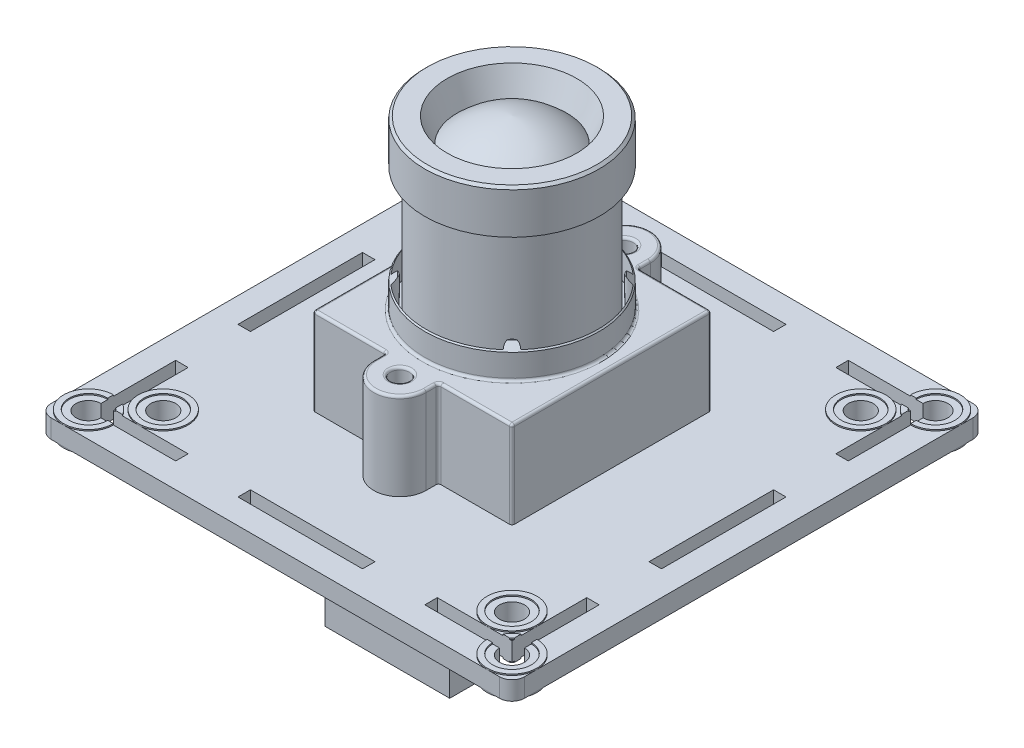
from build123d import *

# Parameters (mm, degrees)
SKETCH1_R                 = 1
PCB_DEPTH                 = 1.5
SKETCH2_R                 = 0.75
LENS_MOUNT_DEPTH          = 7
BOSS_EXTRUDE3_OUTLINE_R   = 7
BOSS_EXTRUDE3_DEPTH       = 2.5
CHAMFER1_SIZE             = 0.5
MOUNTING_HOLES_DEPTH      = 0.1
MOUNTING_HOLES_DEPTH_BACK = 1.6
SKETCH4_R                 = 2
SKETCH4_R_2               = 1.55
SKETCH5_R                 = 6.25
LENS_THREAD_DEPTH         = 10
SKETCH6_R                 = 7
LENS_GLASS_SURROUND_DEPTH = 3.5
CHAMFER2_SIZE             = 0.2
SKETCH7_R                 = 5.2
LENS_RECESS_DEPTH         = 2
CHAMFER3_SIZE2            = 0.808052452
CHAMFER3_SIZE             = 2
SKETCH10_R                = 4.391947548
LENS_CAVITY_DEPTH         = 10
CHAMFER4_SIZE             = 9
CHAMFER4_SIZE2            = 1.913009055
SKETCH11_W                = 10
SKETCH11_H                = 4
BOSS_EXTRUDE4_DEPTH       = 6
SKETCH12_W                = 9
SKETCH12_H                = 3
SKETCH12_W_2              = 2
SKETCH12_H_2              = 0.5
CUT_EXTRUDE1_DEPTH        = 5.5
SKETCH13_W                = 1
SKETCH13_H                = 1
BOSS_EXTRUDE5_DEPTH       = 5.5
BOSS_EXTRUDE5_2_DEPTH     = 5.5
BOSS_EXTRUDE5_3_DEPTH     = 5.5
BOSS_EXTRUDE5_4_DEPTH     = 5.5
CHAMFER5_SIZE             = 0.4
CHAMFER6_SIZE             = 0.4
CHAMFER7_SIZE             = 0.4
CHAMFER8_SIZE             = 0.4
FILLET1_R                 = 0.2
CUT_EXTRUDE2_DEPTH        = 35.727510772
CUT_EXTRUDE2_DEPTH_BACK   = 35.727510772
SKETCH14_W                = 10
SKETCH14_H                = 1
SKETCH14_W_2              = 1
SKETCH14_H_2              = 10


# Read off the part's stored shape, not the designer's step: Boss-Extrude3
# Some blends are built 0.0001 mm under size
with BuildPart() as part:
    # Sketch1 → PCB (new body)
    with BuildSketch(Plane(origin=(0, 0, 0), x_dir=(1, 0, 0), z_dir=(0, 1, 0))):
        with BuildLine():
            Line((-18, -19), (18, -19))
            ThreePointArc((18, -19), (18.707106781, -18.707106781), (19, -18))
            Line((19, -18), (19, 18))
            ThreePointArc((19, 18), (18.707106781, 18.707106781), (18, 19))
            Line((18, 19), (-18, 19))
            ThreePointArc((-18, 19), (-18.707106781, 18.707106781), (-19, 18))
            Line((-19, 18), (-19, -18))
            ThreePointArc((-19, -18), (-18.707106781, -18.707106781), (-18, -19))
        make_face()
        with Locations(Location((-17, -17, 0), (0, 0, 270))):
            Circle(SKETCH1_R, mode=Mode.SUBTRACT)
        with Locations(Location((17, -17, 0), (0, 0, 270))):
            Circle(SKETCH1_R, mode=Mode.SUBTRACT)
        with Locations(Location((17, 17, 0), (0, 0, 270))):
            Circle(SKETCH1_R, mode=Mode.SUBTRACT)
        with Locations(Location((-17, 17, 0), (0, 0, 270))):
            Circle(SKETCH1_R, mode=Mode.SUBTRACT)
        with Locations(Location((-14, 14, 0), (0, 0, 270))):
            Circle(SKETCH1_R, mode=Mode.SUBTRACT)
        with Locations(Location((14, -14, 0), (0, 0, 270))):
            Circle(SKETCH1_R, mode=Mode.SUBTRACT)
        with Locations(Location((14, 14, 0), (0, 0, 270))):
            Circle(SKETCH1_R, mode=Mode.SUBTRACT)
        with Locations(Location((-14, -14, 0), (0, 0, 270))):
            Circle(SKETCH1_R, mode=Mode.SUBTRACT)
    extrude(amount=PCB_DEPTH)

    # Sketch2 → Lens Mount (add)
    with BuildSketch(Plane(origin=(0, 1.5, 0), x_dir=(1, 0, 0), z_dir=(0, 1, 0))):
        with BuildLine():
            Line((-8, 8), (-8, -8))
            Line((-8, -8), (-2.1, -8))
            Line((-2.1, -8), (-2.1, -9))
            ThreePointArc((-2.1, -9), (0, -11.1), (2.1, -9))
            Line((2.1, -9), (2.1, -8))
            Line((2.1, -8), (8, -8))
            Line((8, -8), (8, 8))
            Line((8, 8), (2.1, 8))
            Line((2.1, 8), (2.1, 9))
            ThreePointArc((2.1, 9), (0, 11.1), (-2.1, 9))
            Line((-2.1, 9), (-2.1, 8))
            Line((-2.1, 8), (-8, 8))
        make_face()
        with Locations(Location((0, 9, 0), (0, 0, 270))):
            Circle(SKETCH2_R, mode=Mode.SUBTRACT)
        with Locations(Location((0, -9, 0), (0, 0, 270))):
            Circle(SKETCH2_R, mode=Mode.SUBTRACT)
    extrude(amount=LENS_MOUNT_DEPTH)

    # Boss-Extrude3 outline → Boss-Extrude3 (add)
    with BuildSketch(Plane(origin=(0, 8.5, 0), x_dir=(1, 0, 0), z_dir=(0, 1, 0))):
        Circle(BOSS_EXTRUDE3_OUTLINE_R)
        with BuildLine():
            ThreePointArc((-4.512905634, -5.219548136), (-4.5254834, -4.5254834), (-5.219548136, -4.512905634))
            ThreePointArc((-5.219548136, -4.512905634), (-6.9, 0), (-5.219548136, 4.512905634))
            ThreePointArc((-5.219548136, 4.512905634), (-4.5254834, 4.5254834), (-4.512905634, 5.219548136))
            ThreePointArc((-4.512905634, 5.219548136), (0, 6.9), (4.512905634, 5.219548136))
            ThreePointArc((4.512905634, 5.219548136), (4.5254834, 4.5254834), (5.219548136, 4.512905634))
            ThreePointArc((5.219548136, 4.512905634), (6.9, 0), (5.219548136, -4.512905634))
            ThreePointArc((5.219548136, -4.512905634), (4.5254834, -4.5254834), (4.512905634, -5.219548136))
            ThreePointArc((4.512905634, -5.219548136), (0, -6.9), (-4.512905634, -5.219548136))
        make_face(mode=Mode.SUBTRACT)
    extrude(amount=BOSS_EXTRUDE3_DEPTH)

    # Chamfer1
    # the kernel refuses this chamfer: 0.5 mm, written as the material it takes off along each edge
    with BuildSketch(Plane(origin=(0, 11, 0), x_dir=(1, 0, 0), z_dir=(0, 0, 1))) as chamfer1_piece_1:
        Polygon((7, -CHAMFER1_SIZE), (7 - CHAMFER1_SIZE, 0), (7, 0), align=None)
    revolve(axis=Axis((0, 11, 0), (0, 1, 0)), mode=Mode.SUBTRACT)

    # Sketch4 → Mounting Holes (add, two sides: drawn at the far end of the back side and taken through both)
    # profile 1 of 8: a face of its own
    with BuildSketch(Plane(origin=(0, 1.5, 0), x_dir=(1, 0, 0), z_dir=(0, 1, 0)).offset(-MOUNTING_HOLES_DEPTH_BACK)):
        with Locations(Location((17, -17, 0), (0, 0, 270))):
            Circle(SKETCH4_R)
        with Locations(Location((17, -17, 0), (0, 0, 90))):
            Circle(SKETCH4_R_2, mode=Mode.SUBTRACT)
    # profile 2 of 8: a face of its own
    with BuildSketch(Plane(origin=(0, 1.5, 0), x_dir=(1, 0, 0), z_dir=(0, 1, 0)).offset(-MOUNTING_HOLES_DEPTH_BACK)):
        with Locations(Location((-17, -17, 0), (0, 0, 270))):
            Circle(SKETCH4_R)
        with Locations(Location((-17, -17, 0), (0, 0, 90))):
            Circle(SKETCH4_R_2, mode=Mode.SUBTRACT)
    # profile 3 of 8: a face of its own
    with BuildSketch(Plane(origin=(0, 1.5, 0), x_dir=(1, 0, 0), z_dir=(0, 1, 0)).offset(-MOUNTING_HOLES_DEPTH_BACK)):
        with Locations(Location((-17, 17, 0), (0, 0, 90))):
            Circle(SKETCH4_R)
        with Locations(Location((-17, 17, 0), (0, 0, 90))):
            Circle(SKETCH4_R_2, mode=Mode.SUBTRACT)
    # profile 4 of 8: a face of its own
    with BuildSketch(Plane(origin=(0, 1.5, 0), x_dir=(1, 0, 0), z_dir=(0, 1, 0)).offset(-MOUNTING_HOLES_DEPTH_BACK)):
        with Locations(Location((17, 17, 0), (0, 0, 90))):
            Circle(SKETCH4_R)
        with Locations(Location((17, 17, 0), (0, 0, 90))):
            Circle(SKETCH4_R_2, mode=Mode.SUBTRACT)
    # profile 5 of 8: a face of its own
    with BuildSketch(Plane(origin=(0, 1.5, 0), x_dir=(1, 0, 0), z_dir=(0, 1, 0)).offset(-MOUNTING_HOLES_DEPTH_BACK)):
        with Locations(Location((14, -14, 0), (0, 0, 90))):
            Circle(SKETCH4_R)
        with Locations(Location((14, -14, 0), (0, 0, 90))):
            Circle(SKETCH4_R_2, mode=Mode.SUBTRACT)
    # profile 6 of 8: a face of its own
    with BuildSketch(Plane(origin=(0, 1.5, 0), x_dir=(1, 0, 0), z_dir=(0, 1, 0)).offset(-MOUNTING_HOLES_DEPTH_BACK)):
        with Locations(Location((-14, -14, 0), (0, 0, 90))):
            Circle(SKETCH4_R)
        with Locations(Location((-14, -14, 0), (0, 0, 90))):
            Circle(SKETCH4_R_2, mode=Mode.SUBTRACT)
    # profile 7 of 8: a face of its own
    with BuildSketch(Plane(origin=(0, 1.5, 0), x_dir=(1, 0, 0), z_dir=(0, 1, 0)).offset(-MOUNTING_HOLES_DEPTH_BACK)):
        with Locations(Location((-14, 14, 0), (0, 0, 90))):
            Circle(SKETCH4_R)
        with Locations(Location((-14, 14, 0), (0, 0, 90))):
            Circle(SKETCH4_R_2, mode=Mode.SUBTRACT)
    # profile 8 of 8: a face of its own
    with BuildSketch(Plane(origin=(0, 1.5, 0), x_dir=(1, 0, 0), z_dir=(0, 1, 0)).offset(-MOUNTING_HOLES_DEPTH_BACK)):
        with Locations(Location((14, 14, 0), (0, 0, 90))):
            Circle(SKETCH4_R)
        with Locations(Location((14, 14, 0), (0, 0, 90))):
            Circle(SKETCH4_R_2, mode=Mode.SUBTRACT)
    extrude(amount=MOUNTING_HOLES_DEPTH + MOUNTING_HOLES_DEPTH_BACK)

    # Sketch5 → Lens Thread (add)
    with BuildSketch(Plane(origin=(0, 8.5, 0), x_dir=(1, 0, 0), z_dir=(0, 1, 0))):
        with Locations(Location((0, 0, 0), (0, 0, 90))):
            Circle(SKETCH5_R)
    extrude(amount=LENS_THREAD_DEPTH)

    # Sketch6 → Lens Glass Surround (add)
    with BuildSketch(Plane(origin=(0, 18.5, 0), x_dir=(1, 0, 0), z_dir=(0, 1, 0))):
        with Locations(Location((0, 0, 0), (0, 0, 90))):
            Circle(SKETCH6_R)
    extrude(amount=LENS_GLASS_SURROUND_DEPTH)

    # Chamfer2
    chamfer2_edges = [part.edges().sort_by_distance(p)[0] for p in [
        (0, 22, 7),
    ]]
    chamfer(chamfer2_edges, length=CHAMFER2_SIZE)

    # Sketch7 → Lens Recess (cut)
    with BuildSketch(Plane(origin=(0, 22, 0), x_dir=(1, 0, 0), z_dir=(0, 1, 0))):
        with Locations(Location((0, 0, 0), (0, 0, 270))):
            Circle(SKETCH7_R)
    extrude(amount=-LENS_RECESS_DEPTH, mode=Mode.SUBTRACT)

    # Chamfer3
    chamfer3_edges = [part.edges().sort_by_distance(p)[0] for p in [
        (0, 20, -5.2),
    ]]
    chamfer3_side = [part.faces().sort_by_distance(p)[0] for p in [
        (0, 20.016161049, -5.2),
    ]]
    chamfer(chamfer3_edges, length=CHAMFER3_SIZE - 0.0001, length2=CHAMFER3_SIZE2 - 0.0001, reference=chamfer3_side[0])  # a hair under: the kernel refuses the full size

    # Sketch9 → Glass Lens (revolve)
    with BuildSketch(Plane(origin=(0, 0, 0), x_dir=(0.9889956423843607, -6.796666946599717e-12, -0.14794464959823986), z_dir=(0.14794464959823986, -3.2080034615912436e-12, 0.9889956423843607)), mode=Mode.PRIVATE) as glass_lens_sk:
        with BuildLine():
            Line((0, 20), (-4.391946884, 20))
            ThreePointArc((-4.391946884, 20), (-2.365284698, 21.371803022), (0, 22))
            Line((0, 22), (0, 20))
        make_face()
    revolve(glass_lens_sk.sketch.rotate(Axis((0, 20, 0), (7.1963598239252005e-12, 1.0, 2.1671890524112097e-12)), 261.492165269), axis=Axis((0, 20, 0), (7.1963598239252005e-12, 1.0, 2.1671890524112097e-12)))

    # Sketch10 → Lens Cavity (cut)
    with BuildSketch(Plane(origin=(0, 20, 0), x_dir=(1, 0, 0), z_dir=(0, 1, 0))):
        with Locations(Location((0, 0, 0), (0, 0, 270))):
            Circle(SKETCH10_R)
    extrude(amount=-LENS_CAVITY_DEPTH, mode=Mode.SUBTRACT)


with BuildPart() as lens_cavity_piece_1:
    # of the separate pieces the step leaves, piece 1, a body of its own (lens_cavity_pieces)
    add(part.part.solids().sort_by_distance((0, 21.9999, 5.2))[0])

    # Chamfer4
    chamfer4_edges = [lens_cavity_piece_1.edges().sort_by_distance(p)[0] for p in [
        (0, 10, -4.391947548),
    ]]
    chamfer4_side = [lens_cavity_piece_1.faces().sort_by_distance(p)[0] for p in [
        (0, 15, -4.391947548),
    ]]
    chamfer(chamfer4_edges, length=CHAMFER4_SIZE, length2=CHAMFER4_SIZE2, reference=chamfer4_side[0])

    # Fillet1
    fillet1_edges = [lens_cavity_piece_1.edges().sort_by_distance(p)[0] for p in [
        (8, 5, 8),
        (8, 5, -8),
        (2.1, 5, -8),
        (0, 8.5, -9.75),
        (0, 8.5, 8.25),
        (-7, 8.5, 0),
        (-5.05, 8.5, -8),
        (-8, 8.5, 0),
        (-5.05, 8.5, 8),
        (-2.1, 8.5, 8.5),
        (0, 8.5, 11.1),
        (2.1, 8.5, 8.5),
        (5.05, 8.5, 8),
        (8, 8.5, 0),
        (5.05, 8.5, -8),
        (2.1, 8.5, -8.5),
        (0, 8.5, -11.1),
        (-2.1, 8.5, -8.5),
        (-2.1, 5, -8),
        (-8, 5, -8),
        (-8, 5, 8),
        (-2.1, 5, 8),
        (2.1, 5, 8),
    ]]
    fillet(fillet1_edges, radius=FILLET1_R)

    # Sketch14 → Cut-Extrude2 (cut, two sides: drawn at the far end of the back side and taken through both)
    with BuildSketch(Plane(origin=(0, 0, 0), x_dir=(1, 0, 0), z_dir=(0, 1, 0)).offset(-CUT_EXTRUDE2_DEPTH_BACK)):
        Polygon((-17, 10), (-16, 10), (-16, 16), (-17, 17), align=None)
        Polygon((-17, 17), (-16, 16), (-10, 16), (-10, 17), align=None)
        with Locations((0, 16.5)):
            Rectangle(SKETCH14_W, SKETCH14_H)
        with Locations((-16.5, 0)):
            Rectangle(SKETCH14_W_2, SKETCH14_H_2)
        Polygon((-10, -16), (-16, -16), (-16, -10), (-17, -10), (-17, -17), (-10, -17), align=None)
        with Locations((0, -16.5)):
            Rectangle(SKETCH14_W, SKETCH14_H)
        Polygon((16, -10), (16, -16), (17, -17), (17, -10), align=None)
        with Locations((16.5, 0)):
            Rectangle(SKETCH14_W_2, SKETCH14_H_2)
        Polygon((16, -16), (10, -16), (10, -17), (17, -17), align=None)
        Polygon((16, 16), (16, 10), (17, 10), (17, 17), (10, 17), (10, 16), align=None)
    extrude(amount=CUT_EXTRUDE2_DEPTH + CUT_EXTRUDE2_DEPTH_BACK, mode=Mode.SUBTRACT)


with BuildPart() as lens_cavity_piece_2:
    # of the separate pieces the step leaves, piece 2, a body of its own (lens_cavity_pieces)
    add(part.part.solids().sort_by_distance((0, 22, 0))[0])


with BuildPart() as body_3:
    # Sketch11 → Boss-Extrude4 (new body)
    with BuildSketch(Plane.XZ):
        with Locations((5, 13)):
            Rectangle(SKETCH11_W, SKETCH11_H)
    extrude(amount=BOSS_EXTRUDE4_DEPTH)

    # Sketch12 → Cut-Extrude1 (cut)
    with BuildSketch(Plane.XZ.offset(6)):
        with Locations((5, 13)):
            Rectangle(SKETCH12_W, SKETCH12_H)
        with Locations((5, 11.25)):
            Rectangle(SKETCH12_W_2, SKETCH12_H_2)
    extrude(amount=-CUT_EXTRUDE1_DEPTH, mode=Mode.SUBTRACT)


with BuildPart() as body_4:
    # Sketch13 → Boss-Extrude5 (new body)
    with BuildSketch(Plane.XZ.offset(0.5)):
        with Locations((1.19, 13.5)):
            Rectangle(SKETCH13_W, SKETCH13_H)
    extrude(amount=BOSS_EXTRUDE5_DEPTH)

    # Chamfer8
    chamfer8_edges = [body_4.edges().sort_by_distance(p)[0] for p in [
        (1.19, -6, 13),
        (1.69, -6, 13.5),
        (1.19, -6, 14),
        (0.69, -6, 13.5),
    ]]
    chamfer(chamfer8_edges, length=CHAMFER8_SIZE)


with BuildPart() as body_5:
    # Sketch13 → Boss-Extrude5 2 (new body)
    with BuildSketch(Plane.XZ.offset(0.5)):
        with Locations((3.73, 13.5)):
            Rectangle(SKETCH13_W, SKETCH13_H)
    extrude(amount=BOSS_EXTRUDE5_2_DEPTH)

    # Chamfer7
    chamfer7_edges = [body_5.edges().sort_by_distance(p)[0] for p in [
        (3.73, -6, 13),
        (4.23, -6, 13.5),
        (3.73, -6, 14),
        (3.23, -6, 13.5),
    ]]
    chamfer(chamfer7_edges, length=CHAMFER7_SIZE)


with BuildPart() as body_6:
    # Sketch13 → Boss-Extrude5 3 (new body)
    with BuildSketch(Plane.XZ.offset(0.5)):
        with Locations((6.27, 13.5)):
            Rectangle(SKETCH13_W, SKETCH13_H)
    extrude(amount=BOSS_EXTRUDE5_3_DEPTH)

    # Chamfer5
    chamfer5_edges = [body_6.edges().sort_by_distance(p)[0] for p in [
        (6.27, -6, 13),
        (6.77, -6, 13.5),
        (6.27, -6, 14),
        (5.77, -6, 13.5),
    ]]
    chamfer(chamfer5_edges, length=CHAMFER5_SIZE)


with BuildPart() as body_7:
    # Sketch13 → Boss-Extrude5 4 (new body)
    with BuildSketch(Plane.XZ.offset(0.5)):
        with Locations((8.81, 13.5)):
            Rectangle(SKETCH13_W, SKETCH13_H)
    extrude(amount=BOSS_EXTRUDE5_4_DEPTH)

    # Chamfer6
    chamfer6_edges = [body_7.edges().sort_by_distance(p)[0] for p in [
        (8.81, -6, 13),
        (9.31, -6, 13.5),
        (8.81, -6, 14),
        (8.31, -6, 13.5),
    ]]
    chamfer(chamfer6_edges, length=CHAMFER6_SIZE)


solid = Compound([lens_cavity_piece_1.part, lens_cavity_piece_2.part, body_3.part, body_4.part, body_5.part, body_6.part, body_7.part])
